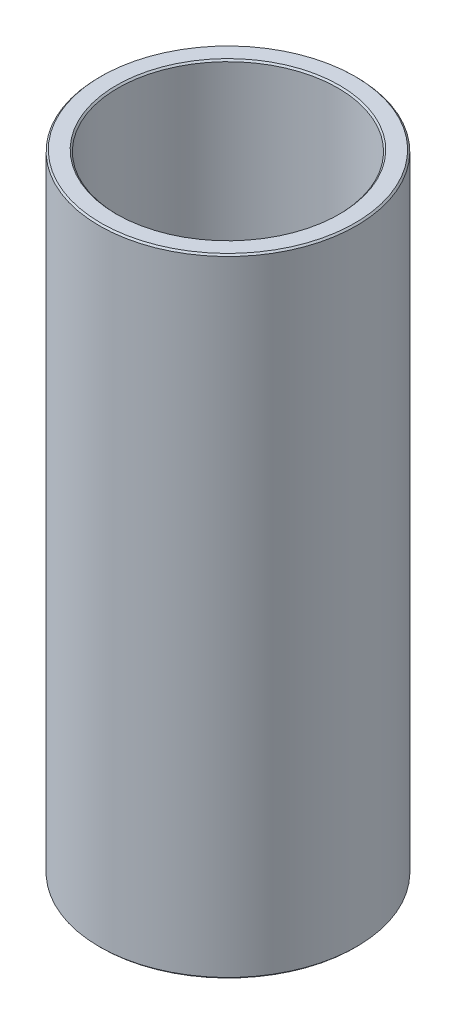
from build123d import *

# Parameters (mm, degrees)
SKETCH1_R           = 27.5
BOSS_EXTRUDE1_DEPTH = 134.179458458
SKETCH2_R           = 23.52917474
CUT_EXTRUDE1_DEPTH  = 140.70192222
CHAMFER1_SIZE       = 0.333730322


with BuildPart() as part:
    # Sketch1 → Boss-Extrude1 (new body)
    with BuildSketch(Plane(origin=(0, 0, 0), x_dir=(1, 0, 0), z_dir=(0, 1, 0))):
        Circle(SKETCH1_R)
    extrude(amount=BOSS_EXTRUDE1_DEPTH)

    # Sketch2 → Cut-Extrude1 (cut, through all)
    with BuildSketch(Plane(origin=(0, 0, 0), x_dir=(1, 0, 0), z_dir=(0, 1, 0))):
        Circle(SKETCH2_R)
    extrude(amount=CUT_EXTRUDE1_DEPTH, mode=Mode.SUBTRACT)

    # Chamfer1
    chamfer1_edges = [part.edges().sort_by_distance(p)[0] for p in [
        (-23.52917474, 134.179458458, 0),
        (-23.52917474, 0, 0),
        (-27.5, 0, 0),
        (-27.5, 134.179458458, 0),
    ]]
    chamfer(chamfer1_edges, length=CHAMFER1_SIZE)


solid = part.part
